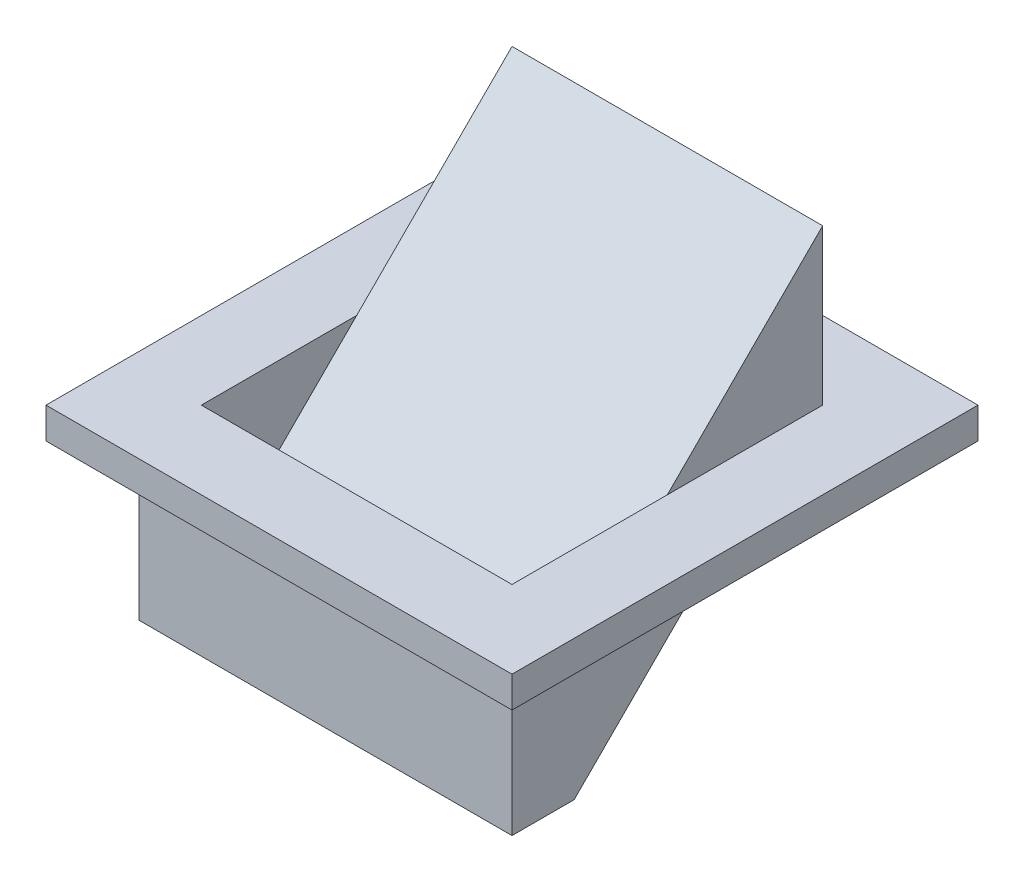
from build123d import *

# Parameters (mm, degrees)
SKETCH1_W           = 150
SKETCH1_H           = 150
BOSS_EXTRUDE1_DEPTH = 10
SKETCH3_W           = 100
SKETCH3_H           = 50
BOSS_EXTRUDE2_DEPTH = 50
CUT_EXTRUDE1_DEPTH  = 205.266982158
SKETCH5_W           = 100
SKETCH5_H           = 50
CUT_EXTRUDE2_DEPTH  = 218.944947177
SKETCH7_W           = 120
SKETCH7_H           = 70
BOSS_EXTRUDE6_DEPTH = 50
BOSS_EXTRUDE7_DEPTH = 100
SKETCH9_W           = 100
SKETCH9_H           = 40
CUT_EXTRUDE4_DEPTH  = 40
BOSS_EXTRUDE8_DEPTH = 100
CUT_EXTRUDE5_DEPTH  = 211.535032714
SHELL1_START        = 35
SHELL1_DEPTH        = 80


# Read off the part's stored shape, not the designer's step: Shell1
with BuildPart() as part:
    # Sketch1 → Boss-Extrude1 (new body)
    with BuildSketch(Plane(origin=(0, 0, 0), x_dir=(1, 0, 0), z_dir=(0, 1, 0))):
        with Locations((75, 75)):
            Rectangle(SKETCH1_W, SKETCH1_H)
    extrude(amount=BOSS_EXTRUDE1_DEPTH)

    # Sketch3 → Boss-Extrude2 (add)
    with BuildSketch(Plane(origin=(0, 10, 0), x_dir=(1, 0, 0), z_dir=(0, 1, 0))):
        with Locations((75, 100)):
            Rectangle(SKETCH3_W, SKETCH3_H)
    extrude(amount=BOSS_EXTRUDE2_DEPTH)

    # Sketch4 → Cut-Extrude1 (cut, through all)
    with BuildSketch(Plane.ZY.offset(-25)):
        Polygon((-125, 60), (-75, 10), (-75, 60), align=None)
    extrude(amount=-CUT_EXTRUDE1_DEPTH, mode=Mode.SUBTRACT)

    # Sketch5 → Cut-Extrude2 (cut, through all)
    with BuildSketch(Plane(origin=(0, 10, 0), x_dir=(1, 0, 0), z_dir=(0, 1, 0))):
        with Locations((75, 50)):
            Rectangle(SKETCH5_W, SKETCH5_H)
    extrude(amount=-CUT_EXTRUDE2_DEPTH, mode=Mode.SUBTRACT)

    # Sketch7 → Boss-Extrude6 (add)
    with BuildSketch(Plane.XZ):
        with Locations((75, -50)):
            Rectangle(SKETCH7_W, SKETCH7_H)
    extrude(amount=BOSS_EXTRUDE6_DEPTH)

    # Sketch6 → Boss-Extrude7 (add)
    with BuildSketch(Plane(origin=(25, 0, 0), x_dir=(0, 0, -1), z_dir=(1, 0, 0))):
        Polygon((75, 0), (75, 10), (65, 0), align=None)
    extrude(amount=BOSS_EXTRUDE7_DEPTH)

    # Sketch9 → Cut-Extrude4 (cut)
    with BuildSketch(Plane(origin=(0, 0, 0), x_dir=(1, 0, 0), z_dir=(0, 1, 0))):
        with Locations((75, 45)):
            Rectangle(SKETCH9_W, SKETCH9_H)
    extrude(amount=-CUT_EXTRUDE4_DEPTH, mode=Mode.SUBTRACT)

    # Sketch10 → Boss-Extrude8 (add)
    with BuildSketch(Plane(origin=(25, 0, 0), x_dir=(0, 0, -1), z_dir=(1, 0, 0))):
        Polygon((65, 0), (25, -40), (65, -40), align=None)
    extrude(amount=BOSS_EXTRUDE8_DEPTH)

    # Sketch11 → Cut-Extrude5 (cut, through all)
    with BuildSketch(Plane(origin=(135, 0, 0), x_dir=(0, 0, -1), z_dir=(1, 0, 0))):
        Polygon((85, 0), (85, -50), (35, -50), align=None)
    extrude(amount=-CUT_EXTRUDE5_DEPTH, mode=Mode.SUBTRACT)

    # Shell1 outline → Shell1 (cut)
    with BuildSketch(Plane.YZ.offset(SHELL1_START)):
        Polygon((45.857864376, -125), (10, -89.142135624), (10, -125), align=None)
    extrude(amount=SHELL1_DEPTH, mode=Mode.SUBTRACT)


solid = part.part
